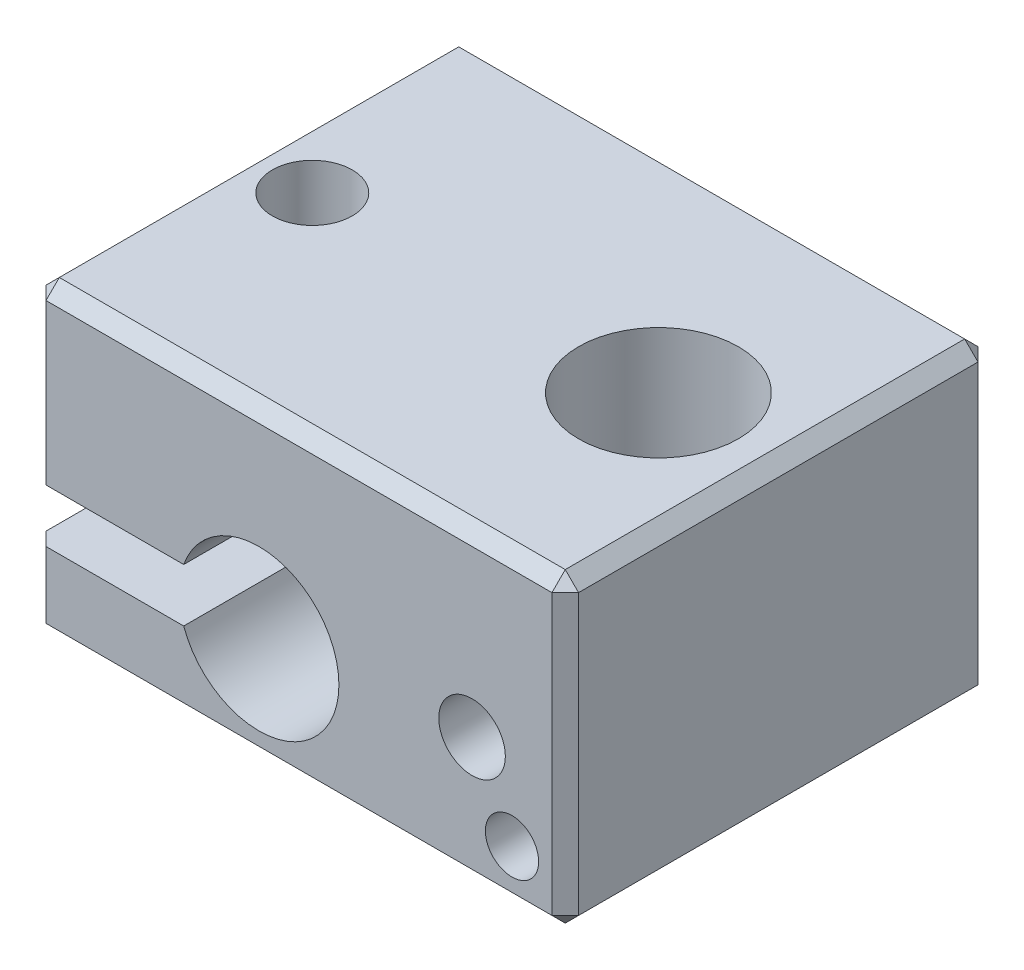
from build123d import *

# Parameters (mm, degrees)
SKETCH1_W           = 20
SKETCH1_H           = 16
SKETCH1_R           = 3
SKETCH1_R_2         = 1.5
BOSS_EXTRUDE1_DEPTH = 11.5
CUT_EXTRUDE1_DEPTH  = 23.096379794
SKETCH3_R           = 1.25
SKETCH3_R_2         = 1
CUT_EXTRUDE2_DEPTH  = 3
CHAMFER1_SIZE       = 0.5


with BuildPart() as part:
    # Sketch1 → Boss-Extrude1 (new body)
    with BuildSketch(Plane(origin=(0, 0, 0), x_dir=(1, 0, 0), z_dir=(0, 1, 0))):
        Rectangle(SKETCH1_W, SKETCH1_H)
        with Locations((5.5, 0)):
            Circle(SKETCH1_R, mode=Mode.SUBTRACT)
        with Locations((-7.5, 0)):
            Circle(SKETCH1_R_2, mode=Mode.SUBTRACT)
    extrude(amount=BOSS_EXTRUDE1_DEPTH)

    # Sketch2 → Cut-Extrude1 (cut, through all)
    with BuildSketch(Plane.XY.offset(8)):
        with BuildLine():
            Line((-10, 5), (-4.328427125, 5))
            ThreePointArc((-4.328427125, 5), (1.5, 4), (-4.328427125, 3))
            Line((-4.328427125, 3), (-10, 3))
            Line((-10, 3), (-10, 5))
        make_face()
    extrude(amount=-CUT_EXTRUDE1_DEPTH, mode=Mode.SUBTRACT)

    # Sketch3 → Cut-Extrude2 (cut)
    with BuildSketch(Plane.XY.offset(8)):
        with Locations((6.5, 4.8)):
            Circle(SKETCH3_R)
        with Locations((8, 2)):
            Circle(SKETCH3_R_2)
    extrude(amount=-CUT_EXTRUDE2_DEPTH, mode=Mode.SUBTRACT)

    # Chamfer1
    chamfer1_edges = [part.edges().sort_by_distance(p)[0] for p in [
        (10, 11.5, 0),
        (0, 11.5, 8),
        (-10, 8.25, 8),
        (-10, 11.5, 0),
        (-10, 8.25, -8),
        (0, 11.5, -8),
        (-10, 1.5, -8),
        (-10, 1.5, 8),
        (10, 5.75, -8),
        (10, 0, 0),
        (10, 5.75, 8),
        (0, 0, -8),
        (-10, 0, 0),
        (0, 0, 8),
    ]]
    chamfer(chamfer1_edges, length=CHAMFER1_SIZE)


solid = part.part
